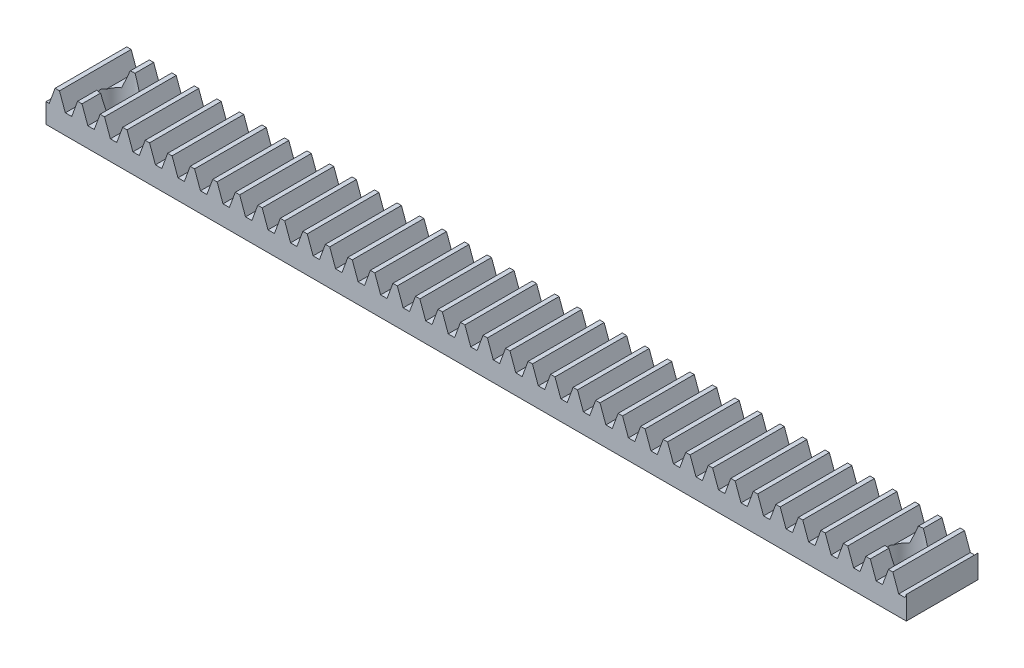
from build123d import *

# Parameters (mm, degrees)
BLANKSKE_W         = 60
BLANKSKE_H         = 2.5
BLANK_DEPTH        = 5
TOOTHCUTSIM_DEPTH  = 61.259853966
TEETHCUTS_COUNT    = 40
TEETHCUTS_PITCH    = 1.570796325
SKETCH1_R          = 1.2
CUT_EXTRUDE1_DEPTH = 10


with BuildPart() as part:
    # BlankSke → Blank (new body)
    with BuildSketch(Plane.XY):
        with Locations((30, 1.25)):
            Rectangle(BLANKSKE_W, BLANKSKE_H)
    extrude(amount=-BLANK_DEPTH)

    # TooCutSkeSim → ToothCutSim (cut, through all)
    with BuildSketch(Plane.XY):
        Polygon((0.222217685, 1.375), (-0.222217685, 1.375), (-0.640929042, 2.5254), (0.640929042, 2.5254), align=None)
    toothcutsim = extrude(amount=-TOOTHCUTSIM_DEPTH, mode=Mode.SUBTRACT)

    # TeethCuts: ToothCutSim ×40
    with Locations(*[(i * TEETHCUTS_PITCH, 0, 0) for i in range(1, TEETHCUTS_COUNT)]):
        add(toothcutsim, mode=Mode.SUBTRACT)

    # Sketch1 → Cut-Extrude1 (cut)
    with BuildSketch(Plane.XZ):
        with Locations((2.5, -2.5)):
            Circle(SKETCH1_R)
        with Locations((57.5, -2.5)):
            Circle(SKETCH1_R)
    extrude(amount=-CUT_EXTRUDE1_DEPTH, mode=Mode.SUBTRACT)


solid = part.part
